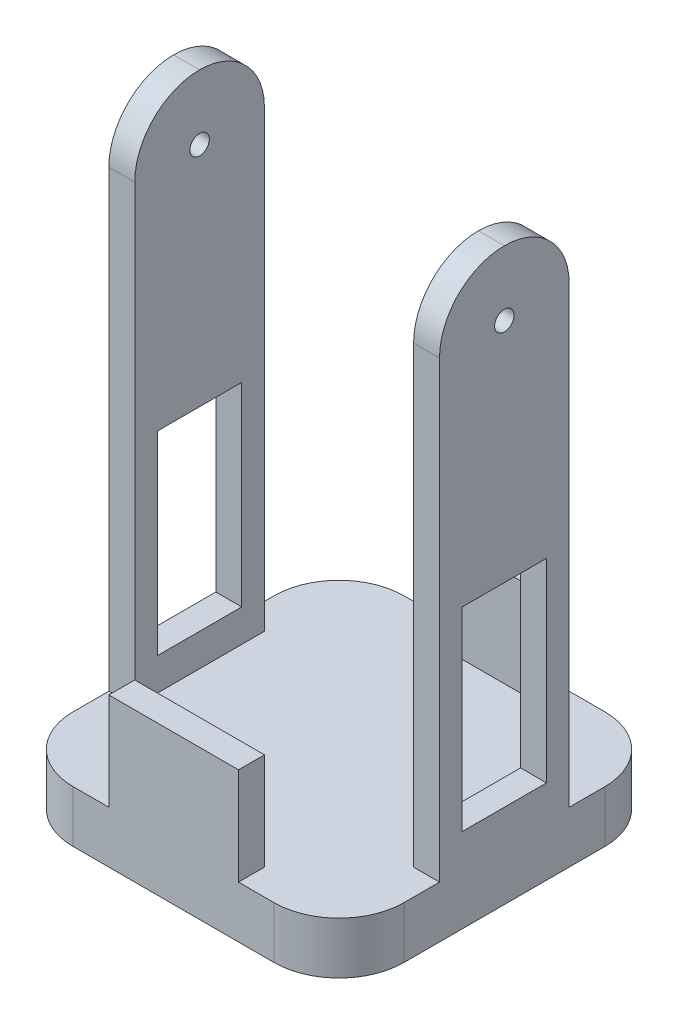
from build123d import *

# Parameters (mm, degrees)
ESBO_O1_W                  = 51
ESBO_O1_H                  = 51
RESSALTO_EXTRUS_O1_DEPTH   = 8
ESBO_O2_W                  = 4
ESBO_O2_H                  = 20
RESSALTO_EXTRUS_O2_DEPTH   = 80
ESBO_O4_W                  = 20
ESBO_O4_H                  = 4
RESSALTO_EXTRUS_O3_DEPTH   = 15
ESBO_O5_R                  = 1.6
CORTE_EXTRUS_O2_DEPTH      = 7
FILETE2_R                  = 10
CORTE_EXTRUS_O3_DEPTH      = 105.858237635
CORTE_EXTRUS_O3_DEPTH_BACK = 105.858237635
ESBO_O6_W                  = 13
ESBO_O6_H                  = 30
ESBO_O7_R                  = 1.5
CORTE_EXTRUS_O4_DEPTH      = 105.858237635
FILETE6_R                  = 10


with BuildPart() as part:
    # Esboço1 → Ressalto-extrusão1 (new body)
    with BuildSketch(Plane(origin=(0, 0, 0), x_dir=(1, 0, 0), z_dir=(0, 1, 0))):
        Rectangle(ESBO_O1_W, ESBO_O1_H)
    extrude(amount=RESSALTO_EXTRUS_O1_DEPTH)

    # Esboço2 → Ressalto-extrusão2 (add)
    with BuildSketch(Plane(origin=(0, 8, 0), x_dir=(1, 0, 0), z_dir=(0, 1, 0))):
        with Locations((-23.5, 0)):
            Rectangle(ESBO_O2_W, ESBO_O2_H)
        with Locations((23.5, 0)):
            Rectangle(ESBO_O2_W, ESBO_O2_H)
    extrude(amount=RESSALTO_EXTRUS_O2_DEPTH)

    # Esboço4 → Ressalto-extrusão3 (add)
    with BuildSketch(Plane(origin=(0, 8, 0), x_dir=(1, 0, 0), z_dir=(0, 1, 0))):
        with Locations((0, 23.5)):
            Rectangle(ESBO_O4_W, ESBO_O4_H)
        with Locations((0, -23.5)):
            Rectangle(ESBO_O4_W, ESBO_O4_H)
    extrude(amount=RESSALTO_EXTRUS_O3_DEPTH)

    # Esboço5 → Corte-extrusão2 (cut)
    with BuildSketch(Plane.XZ):
        with Locations(Location((-11, 11, 0), (0, 0, 270))):
            Circle(ESBO_O5_R)
        with Locations(Location((11, 11, 0), (0, 0, 90))):
            Circle(ESBO_O5_R)
        with Locations(Location((11, -11, 0), (0, 0, 270))):
            Circle(ESBO_O5_R)
        with Locations(Location((-11, -11, 0), (0, 0, 90))):
            Circle(ESBO_O5_R)
    extrude(amount=-CORTE_EXTRUS_O2_DEPTH, mode=Mode.SUBTRACT)

    # Filete2
    filete2_edges = [part.edges().sort_by_distance(p)[0] for p in [
        (25.5, 4, 25.5),
        (-25.5, 4, 25.5),
        (-25.5, 4, -25.5),
        (25.5, 4, -25.5),
    ]]
    fillet(filete2_edges, radius=FILETE2_R)

    # Esboço6 → Corte-extrusão3 (cut, two sides: drawn at the far end of the back side and taken through both)
    with BuildSketch(Plane.ZY.offset(25.5).offset(-CORTE_EXTRUS_O3_DEPTH_BACK)):
        with Locations((0, 28)):
            Rectangle(ESBO_O6_W, ESBO_O6_H)
    extrude(amount=CORTE_EXTRUS_O3_DEPTH + CORTE_EXTRUS_O3_DEPTH_BACK, mode=Mode.SUBTRACT)

    # Esboço7 → Corte-extrusão4 (cut, through all)
    with BuildSketch(Plane(origin=(25.5, 0, 0), x_dir=(0, 0, -1), z_dir=(1, 0, 0))):
        with Locations((0, 78)):
            Circle(ESBO_O7_R)
    extrude(amount=-CORTE_EXTRUS_O4_DEPTH, mode=Mode.SUBTRACT)

    # Filete6
    filete6_edges = [part.edges().sort_by_distance(p)[0] for p in [
        (23.5, 88, -10),
        (23.5, 88, 10),
        (-23.5, 88, -10),
        (-23.5, 88, 10),
    ]]
    fillet(filete6_edges, radius=FILETE6_R - 0.0001)  # a hair under: the kernel refuses the full size


solid = part.part
